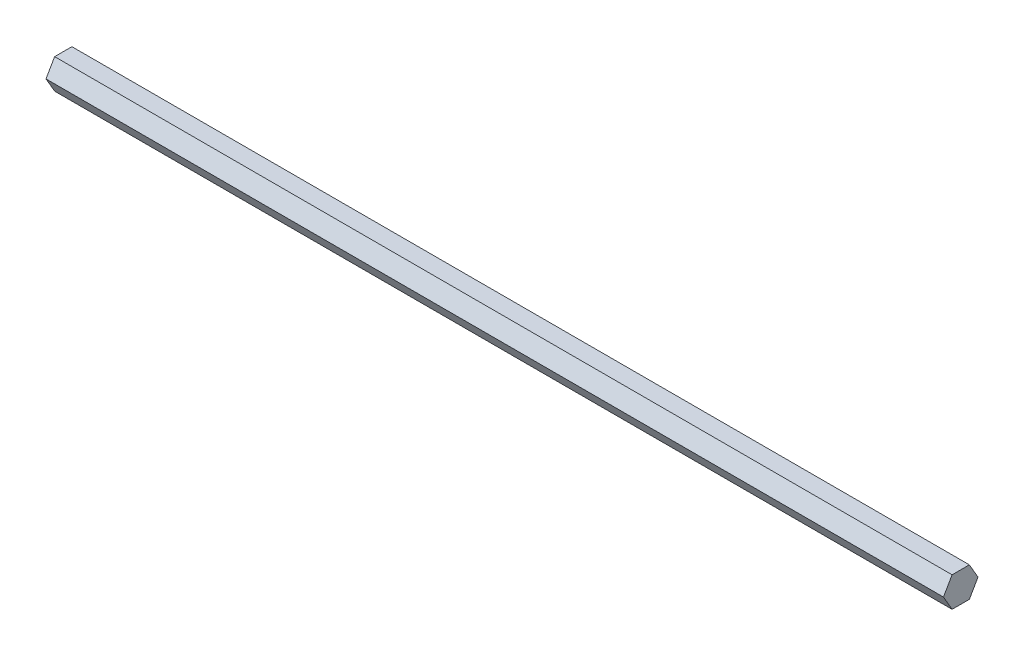
from build123d import *

# Parameters (mm, degrees)
BOSS_EXTRUDE1_DEPTH = 190.5


with BuildPart() as part:
    # Sketch1 → Boss-Extrude1 (new, symmetric)
    with BuildSketch(Plane(origin=(0, 0, 0), x_dir=(0, 0, -1), z_dir=(1, 0, 0))):
        Polygon((7.332348419, 0), (3.666174209, 6.35), (-3.666174209, 6.35), (-7.332348419, 0), (-3.666174209, -6.35), (3.666174209, -6.35), align=None)
    extrude(amount=BOSS_EXTRUDE1_DEPTH, both=True)


solid = part.part
